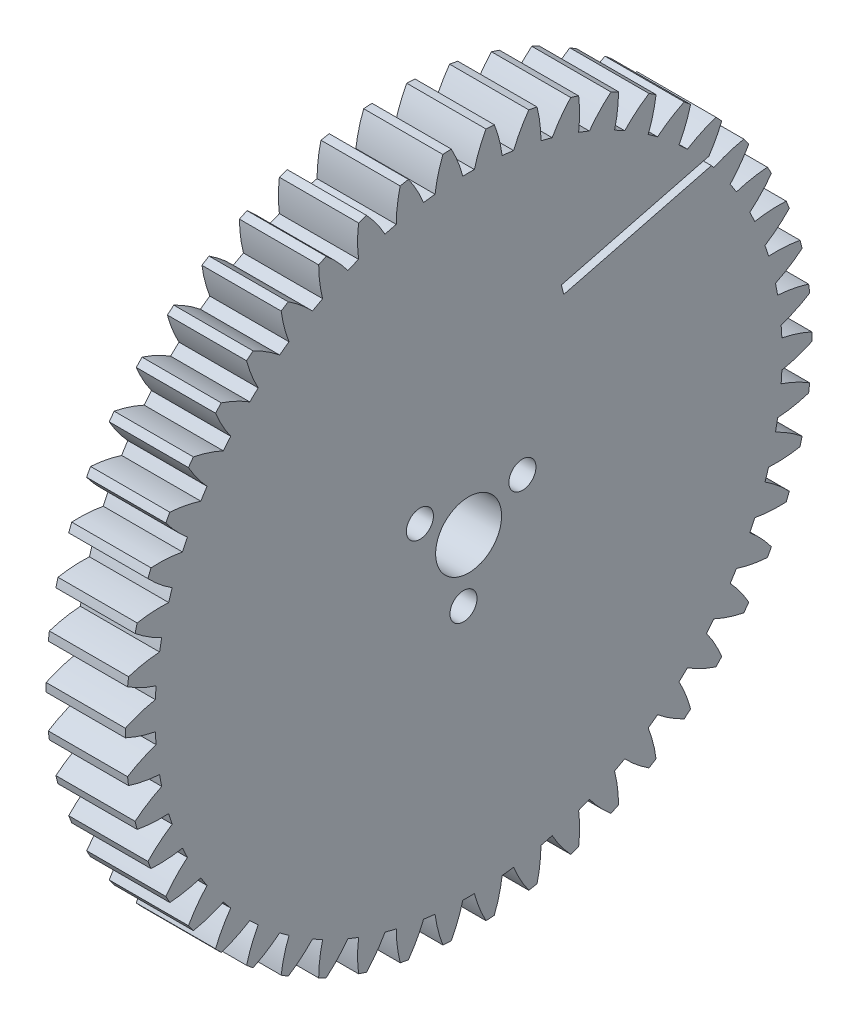
from build123d import *

# Parameters (mm, degrees)
BASPROSKE_W                  = 6
BASPROSKE_H                  = 26
TOOTHCUT_DEPTH               = 38.25587202
TEETHCUTS_COUNT              = 50
TEETHCUTS_ANGLE              = 352.8
BORSKE_R                     = 2.5
BORE_DEPTH                   = 50.0000508
F_2_05_2_05_DIAMETER_HOLE1_D = 2.05
SKETCH3_W                    = 6.552849586
SKETCH3_H                    = 0.7366
CUT_EXTRUDE1_DEPTH           = 223.549202875


with BuildPart() as part:
    # BasProSke → Base-Revolve (revolve)
    with BuildSketch(Plane(origin=(0, 0, 0), x_dir=(1, 0, 0), z_dir=(0, 1, 0))):
        with Locations((3, 13)):
            Rectangle(BASPROSKE_W, BASPROSKE_H)
    revolve(axis=Axis((-10, 0, 0), (1, 0, 0)))

    # TooCutSke → ToothCut (cut, through all)
    with BuildSketch(Plane(origin=(0, 0, 0), x_dir=(0, 0, -1), z_dir=(1, 0, 0))):
        with BuildLine():
            ThreePointArc((0.437663408, 23.744966872), (0, 23.749), (-0.437663408, 23.744966872))
            ThreePointArc((-0.437663408, 23.744966872), (-0.815428123, 24.895236298), (-1.329433358, 25.991422664))
            ThreePointArc((-1.329433358, 25.991422664), (0, 26.0254), (1.329433358, 25.991422664))
            ThreePointArc((1.329433358, 25.991422664), (0.815428123, 24.895236298), (0.437663408, 23.744966872))
        make_face()
    toothcut = extrude(amount=TOOTHCUT_DEPTH, mode=Mode.SUBTRACT)

    # TeethCuts: ToothCut ×50 about axis
    teethcuts_axis = Axis((-10, 0, 0), (1, 0, 0))
    for i in range(1, TEETHCUTS_COUNT):
        add(toothcut.rotate(teethcuts_axis, i * TEETHCUTS_ANGLE / (TEETHCUTS_COUNT - 1)), mode=Mode.SUBTRACT)

    # BorSke → Bore (cut, symmetric)
    with BuildSketch(Plane(origin=(0, 0, 0), x_dir=(0, 0, -1), z_dir=(1, 0, 0))):
        Circle(BORSKE_R)
    extrude(amount=BORE_DEPTH, both=True, mode=Mode.SUBTRACT)

    # Ø2.05 (2.05) Diameter Hole1 (through all)
    with Locations(Plane(origin=(-8.795501481, -164.786714684, -27.965211852), x_dir=(0, 0, 1), z_dir=(-1, 0, 0))):
        with Locations((23.889274715, 166.693737615), (31.654710724, 167.363068324), (28.351650117, 160.303338115)):
            Hole(F_2_05_2_05_DIAMETER_HOLE1_D / 2)

    # Sketch3 → Cut-Extrude1 (cut, through all)
    with BuildSketch(Plane(origin=(97.094558595, -158.901719939, -50.970586717), x_dir=(1, 0, 0), z_dir=(-6.720294097404322e-15, -0.2478292519718614, 0.9688037272157183))):
        with Locations((-93.984376616, 176.944880916)):
            Rectangle(SKETCH3_W, SKETCH3_H)
    extrude(amount=-CUT_EXTRUDE1_DEPTH, mode=Mode.SUBTRACT)


solid = part.part
